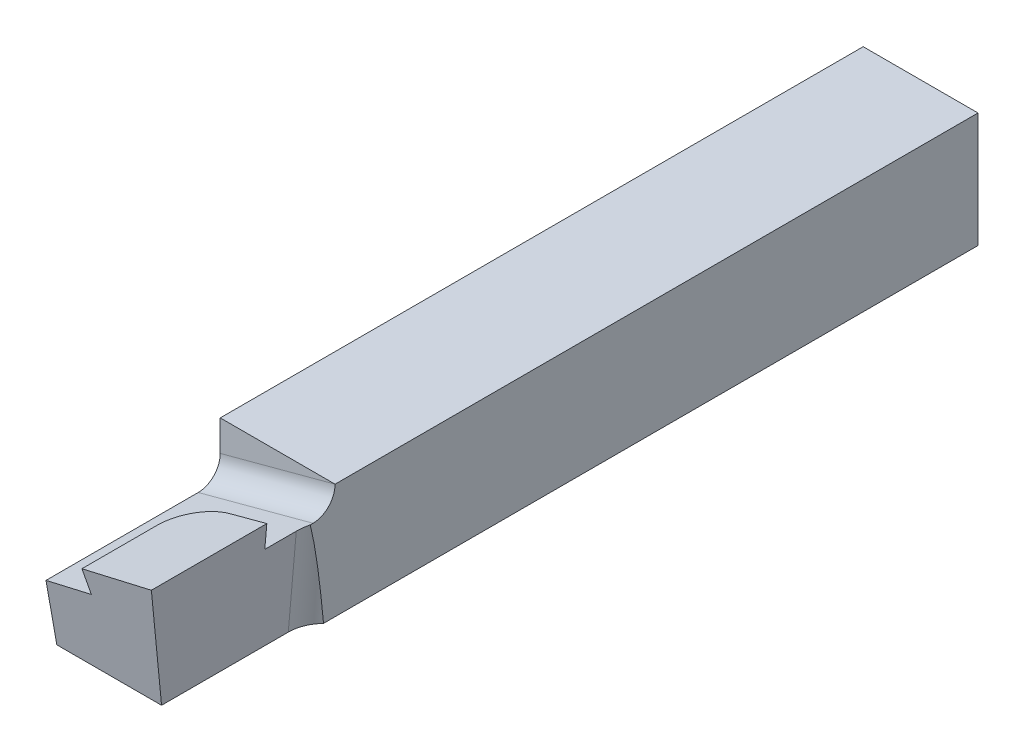
from build123d import *

# Parameters (mm, degrees)
SKETCH1_W           = 7.9375
SKETCH1_H           = 7.9375
BOSS_EXTRUDE1_DEPTH = 57.15
SKETCH2_OUTSIDE_W   = 21.586
SKETCH2_OUTSIDE_H   = 21.586
CUT_EXTRUDE1_DEPTH  = 12.7
FILLET2_R           = 2.54
CUT_EXTRUDE2_DEPTH  = 58.834914911
CUT_EXTRUDE3_DEPTH  = 1.524
FILLET3_R           = 1.524


with BuildPart() as part:
    # Sketch1 → Boss-Extrude1 (new body)
    with BuildSketch(Plane.XY):
        Rectangle(SKETCH1_W, SKETCH1_H)
    extrude(amount=BOSS_EXTRUDE1_DEPTH)

    # Sketch2 outside → Cut-Extrude1 (cut)
    with BuildSketch(Plane.XY.offset(57.15)):
        Rectangle(SKETCH2_OUTSIDE_W, SKETCH2_OUTSIDE_H)
        Polygon((-3.96875, 1.841903285), (3.96875, 3.96875), (3.274308733, -3.96875), (-3.96875, -3.96875), align=None, mode=Mode.SUBTRACT)
    extrude(amount=-CUT_EXTRUDE1_DEPTH, mode=Mode.SUBTRACT)

    # Fillet2
    # the kernel refuses this fillet: 2.54 mm, written as the material it adds along each edge
    with BuildSketch(Plane(origin=(4.522188966, 10.294586333, 44.45), x_dir=(0.9961946980917462, -0.08715574274765137, 0), z_dir=(-0.08715574274765137, -0.9961946980917462, 0))) as fillet2_piece_1_section:
        with BuildLine():
            CenterArc((FILLET2_R, FILLET2_R), FILLET2_R, 180, 90)
            Line((0, FILLET2_R), (0, 0))
            Line((0, 0), (FILLET2_R, 0))
        make_face()
    fillet2_piece_1 = extrude(amount=20.667819961, mode=Mode.PRIVATE)
    fillet2_piece_1 = split(fillet2_piece_1, bisect_by=Plane(origin=(3.717682753, -3.96875, 45.282950751), z_dir=(0, 1, 0)), keep=Keep.TOP, mode=Mode.PRIVATE)
    fillet2_piece_1 = split(fillet2_piece_1, bisect_by=Plane(origin=(3.96875, -1.099038231, 45.282950751), z_dir=(-1, 0, 0)), keep=Keep.TOP, mode=Mode.PRIVATE)
    add(fillet2_piece_1)

    # Sketch3 → Cut-Extrude2 (cut, through all)
    with BuildSketch(Plane(origin=(3.96875, 0, 0), x_dir=(0, 0, -1), z_dir=(1, 0, 0))):
        Polygon((-57.15, 3.96875), (-55.750404591, -3.96875), (-57.15, -3.96875), align=None)
    extrude(amount=-CUT_EXTRUDE2_DEPTH, mode=Mode.SUBTRACT)

    # Sketch4 → Cut-Extrude3 (cut)
    with BuildSketch(Plane(origin=(-0.726331661, 2.710706661, 0), x_dir=(0.96592582628907, 0.2588190451025147, 0), z_dir=(-0.25881904510251463, 0.9659258262890699, 0))):
        Polygon((-3.356798474, -44.45), (-5.976622114, -44.45), (-5.976622114, -56.911870861), (-0.35721527, -56.911870861), (-3.356798474, -56.77497954), align=None)
        with BuildLine():
            Line((4.860706208, -44.45), (-3.356798474, -44.45))
            Line((-3.356798474, -44.45), (-3.356798474, -56.77497954))
            Line((-3.356798474, -56.77497954), (-0.35721527, -56.911870861))
            Line((-0.35721527, -56.911870861), (-0.35721527, -51.706707489))
            ThreePointArc((-0.35721527, -51.706707489), (0.386733506, -49.910656265), (2.18278473, -49.166707489))
            Line((2.18278473, -49.166707489), (4.860706208, -49.166707489))
            Line((4.860706208, -49.166707489), (4.860706208, -46.989995764))
            Line((4.860706208, -46.989995764), (4.860706208, -44.45))
        make_face()
        Polygon((8.895382264, -44.45), (4.860706208, -44.45), (4.860706208, -46.989995764), (4.860706208, -49.166707489), (4.860706208, -57.15), (8.895382264, -57.15), align=None)
    extrude(amount=-CUT_EXTRUDE3_DEPTH, mode=Mode.SUBTRACT)

    # Fillet3
    fillet3_edges = [part.edges().sort_by_distance(p)[0] for p in [
        (0, 1.327565744, 44.45),
    ]]
    fillet(fillet3_edges, radius=FILLET3_R)


solid = part.part
